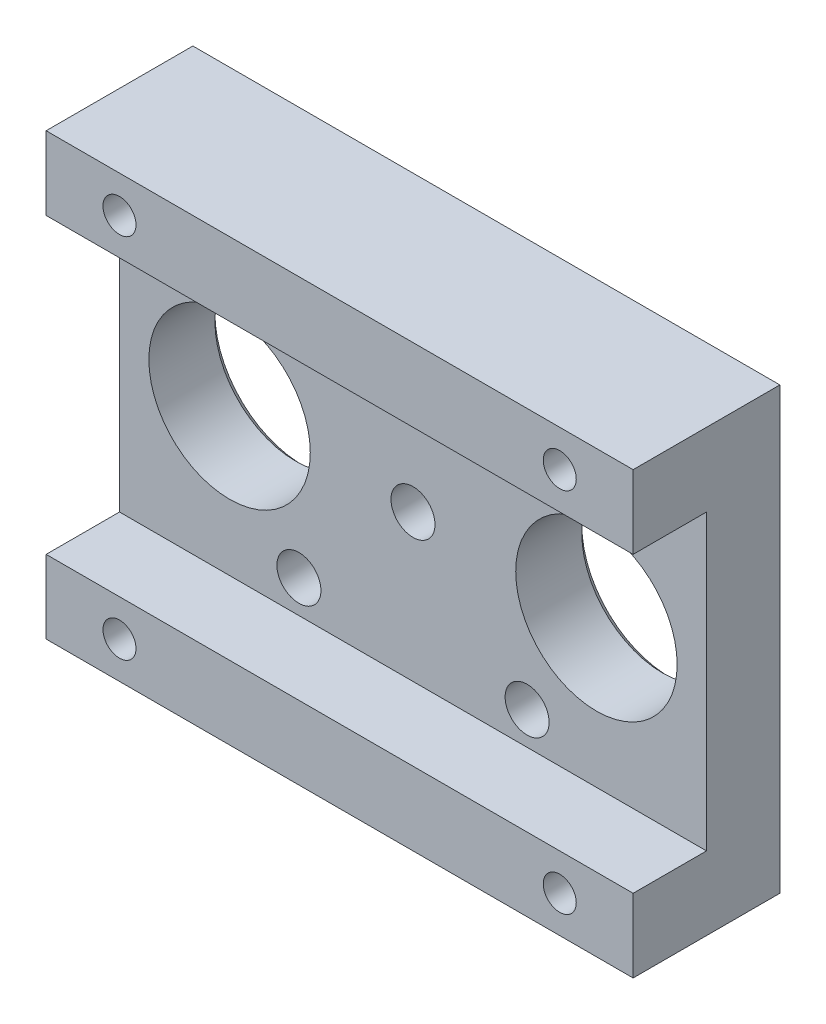
from build123d import *

# Parameters (mm, degrees)
SKIZZE1_W                       = 80
SKIZZE1_H                       = 60
AUFSATZ_LINEAR_AUSTRAGEN1_DEPTH = 10
SKIZZE2_W                       = 80
SKIZZE2_H                       = 10
AUFSATZ_LINEAR_AUSTRAGEN2_DEPTH = 10
SKIZZE3_R                       = 11.35
SCHNITT_LINEAR_AUSTRAGEN1_DEPTH = 2.2
SKIZZE4_R                       = 3
SCHNITT_LINEAR_AUSTRAGEN2_DEPTH = 12.2
SKIZZE5_R                       = 2.25
SCHNITT_LINEAR_AUSTRAGEN3_DEPTH = 12.2
SKIZZE6_R                       = 11
SCHNITT_LINEAR_AUSTRAGEN4_DEPTH = 12.2
SKIZZE7_R                       = 1.6
SCHNITT_LINEAR_AUSTRAGEN5_DEPTH = 12.2
SKIZZE8_R                       = 3
SCHNITT_LINEAR_AUSTRAGEN6_DEPTH = 6
FASE1_SIZE                      = 1


with BuildPart() as part:
    # Skizze1 → Aufsatz-Linear austragen1 (new body)
    with BuildSketch(Plane.XY):
        Rectangle(SKIZZE1_W, SKIZZE1_H)
    extrude(amount=AUFSATZ_LINEAR_AUSTRAGEN1_DEPTH)

    # Skizze2 → Aufsatz-Linear austragen2 (add)
    with BuildSketch(Plane.XY.offset(10)):
        with Locations((0, 25)):
            Rectangle(SKIZZE2_W, SKIZZE2_H)
        with Locations((0, -25)):
            Rectangle(SKIZZE2_W, SKIZZE2_H)
    extrude(amount=AUFSATZ_LINEAR_AUSTRAGEN2_DEPTH)

    # Skizze3 → Schnitt-Linear austragen1 (cut)
    with BuildSketch(Plane(origin=(0, 0, 0), x_dir=(-1, 0, 0), z_dir=(0, 0, -1))):
        Circle(SKIZZE3_R)
    extrude(amount=-SCHNITT_LINEAR_AUSTRAGEN1_DEPTH, mode=Mode.SUBTRACT)

    # Skizze4 → Schnitt-Linear austragen2 (cut)
    with BuildSketch(Plane(origin=(0, 0, 2.2), x_dir=(-1, 0, 0), z_dir=(0, 0, -1))):
        Circle(SKIZZE4_R)
    extrude(amount=-SCHNITT_LINEAR_AUSTRAGEN2_DEPTH, mode=Mode.SUBTRACT)

    # Skizze5 → Schnitt-Linear austragen3 (cut)
    with BuildSketch(Plane.XY.offset(20)):
        with Locations((30, 25)):
            Circle(SKIZZE5_R)
        with Locations((-30, 25)):
            Circle(SKIZZE5_R)
        with Locations((-30, -25)):
            Circle(SKIZZE5_R)
        with Locations((30, -25)):
            Circle(SKIZZE5_R)
    extrude(amount=-SCHNITT_LINEAR_AUSTRAGEN3_DEPTH, mode=Mode.SUBTRACT)

    # Skizze6 → Schnitt-Linear austragen4 (cut)
    with BuildSketch(Plane.XY.offset(10)):
        with Locations((-25, 0)):
            Circle(SKIZZE6_R)
        with Locations((25, 0)):
            Circle(SKIZZE6_R)
    extrude(amount=-SCHNITT_LINEAR_AUSTRAGEN4_DEPTH, mode=Mode.SUBTRACT)

    # Skizze7 → Schnitt-Linear austragen5 (cut)
    with BuildSketch(Plane.XY.offset(10)):
        with Locations((-15.55, 15.55)):
            Circle(SKIZZE7_R)
        with Locations((15.55, 15.55)):
            Circle(SKIZZE7_R)
        with Locations((15.55, -15.55)):
            Circle(SKIZZE7_R)
        with Locations((-15.55, -15.55)):
            Circle(SKIZZE7_R)
    extrude(amount=-SCHNITT_LINEAR_AUSTRAGEN5_DEPTH, mode=Mode.SUBTRACT)

    # Skizze8 → Schnitt-Linear austragen6 (cut)
    with BuildSketch(Plane.XY.offset(10)):
        with Locations((-15.55, 15.55)):
            Circle(SKIZZE8_R)
        with Locations((15.55, 15.55)):
            Circle(SKIZZE8_R)
        with Locations((-15.55, -15.55)):
            Circle(SKIZZE8_R)
        with Locations((15.55, -15.55)):
            Circle(SKIZZE8_R)
    extrude(amount=-SCHNITT_LINEAR_AUSTRAGEN6_DEPTH, mode=Mode.SUBTRACT)

    # Fase1
    fase1_edges = [part.edges().sort_by_distance(p)[0] for p in [
        (14, 0, 0),
        (-36, 0, 0),
    ]]
    chamfer(fase1_edges, length=FASE1_SIZE)


solid = part.part
